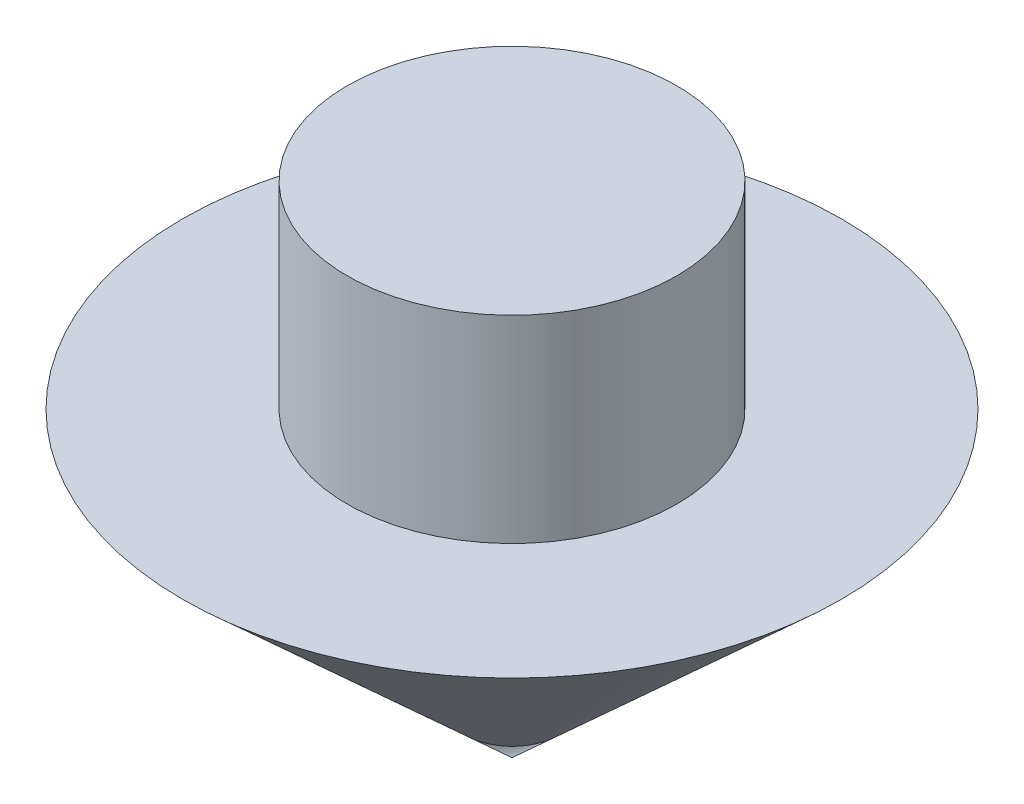
from build123d import *

# Parameters (mm, degrees)
SKETCH2_W = 5
SKETCH2_H = 6


with BuildPart() as part:
    # Sketch1 → Revolve1 (revolve)
    with BuildSketch(Plane.XY):
        Polygon((0, 9.16331174), (0, 0), (10, 9.16331174), align=None)
    revolve(axis=Axis((0, 0, 0), (0, 1, 0)))

    # Sketch2 → Revolve2 (revolve)
    with BuildSketch(Plane.XY):
        with Locations((2.5, 12.16331174)):
            Rectangle(SKETCH2_W, SKETCH2_H)
    revolve(axis=Axis((0, 0, 0), (0, 1, 0)))


solid = part.part
